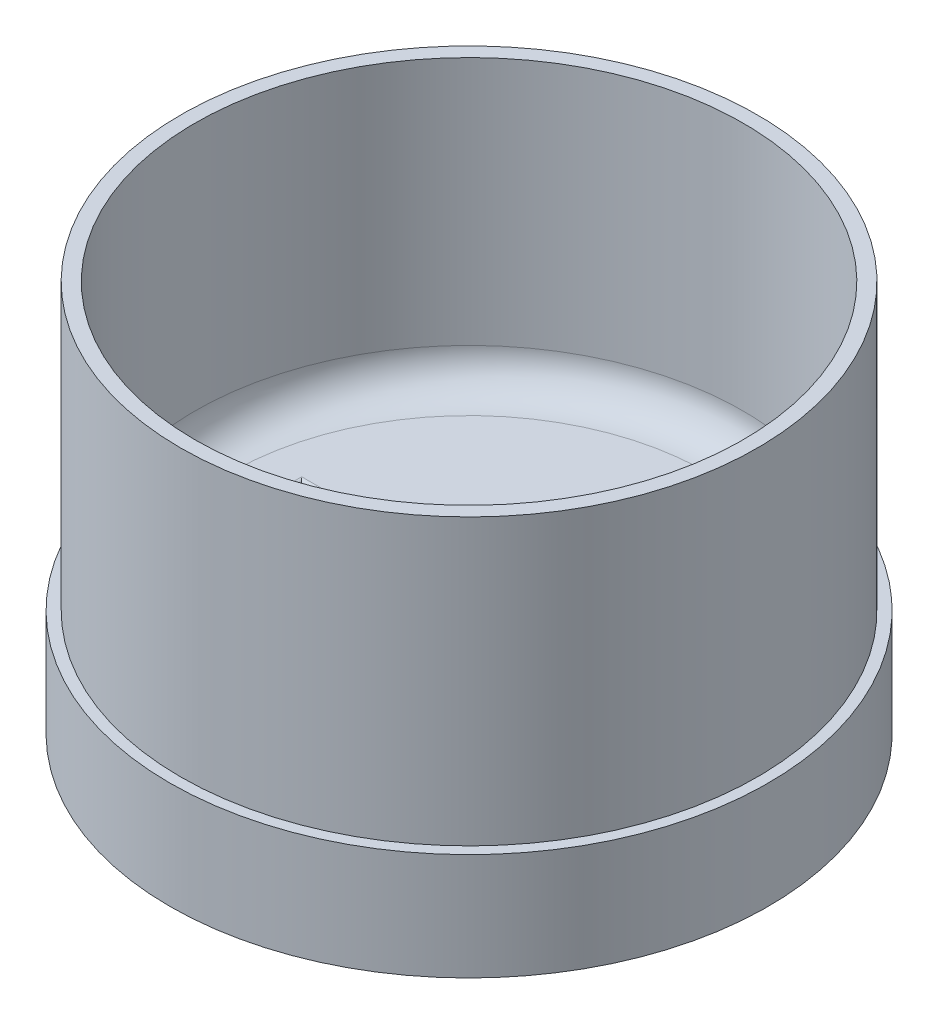
from build123d import *

# Parameters (mm, degrees)
SKETCH1_R           = 84
SKETCH1_R_2         = 79
BOSS_EXTRUDE1_DEPTH = 25
SKETCH2_R           = 84
BOSS_EXTRUDE2_DEPTH = 5
SKETCH3_R           = 81
SKETCH3_R_2         = 77
BOSS_EXTRUDE3_DEPTH = 80
FILLET1_R           = 10
CUT_EXTRUDE1_REACH  = 148.072
SKETCH4_W           = 14
SKETCH4_H           = 7
CUT_EXTRUDE2_REACH  = 145.22
SKETCH5_W           = 10
SKETCH5_H           = 16
FILLET2_R           = 1


with BuildPart() as part:
    # Sketch1 → Boss-Extrude1 (new body)
    with BuildSketch(Plane(origin=(0, 0, 0), x_dir=(1, 0, 0), z_dir=(0, 1, 0))):
        Circle(SKETCH1_R)
        Circle(SKETCH1_R_2, mode=Mode.SUBTRACT)
    extrude(amount=BOSS_EXTRUDE1_DEPTH)

    # Sketch2 → Boss-Extrude2 (add)
    with BuildSketch(Plane(origin=(0, 25, 0), x_dir=(1, 0, 0), z_dir=(0, 1, 0))):
        Circle(SKETCH2_R)
    extrude(amount=BOSS_EXTRUDE2_DEPTH)

    # Sketch3 → Boss-Extrude3 (add)
    with BuildSketch(Plane(origin=(0, 30, 0), x_dir=(1, 0, 0), z_dir=(0, 1, 0))):
        Circle(SKETCH3_R)
        Circle(SKETCH3_R_2, mode=Mode.SUBTRACT)
    extrude(amount=BOSS_EXTRUDE3_DEPTH)

    # Fillet1
    fillet1_edges = [part.edges().sort_by_distance(p)[0] for p in [
        (-79, 25, 0),
        (-77, 30, 0),
    ]]
    fillet(fillet1_edges, radius=FILLET1_R)

    # Sketch4 → Cut-Extrude1 (cut, up to next)
    with BuildSketch(Plane.XZ.offset(-25), mode=Mode.PRIVATE) as cut_extrude1_sk1:
        Rectangle(SKETCH4_W, SKETCH4_H)
    cut_extrude1_tool1 = extrude(cut_extrude1_sk1.sketch, amount=-CUT_EXTRUDE1_REACH, mode=Mode.PRIVATE) & part.part
    add(cut_extrude1_tool1.solids().sort_by_distance((0, 25, 0))[0], mode=Mode.SUBTRACT)

    # Sketch5 → Cut-Extrude2 (cut, up to next)
    with BuildSketch(Plane(origin=(0, 30, 0), x_dir=(1, 0, 0), z_dir=(0, 1, 0)), mode=Mode.PRIVATE) as cut_extrude2_sk1:
        with Locations((-50, 0)):
            Rectangle(SKETCH5_W, SKETCH5_H)
    cut_extrude2_tool1 = extrude(cut_extrude2_sk1.sketch, amount=-CUT_EXTRUDE2_REACH, mode=Mode.PRIVATE) & part.part
    add(cut_extrude2_tool1.solids().sort_by_distance((-50, 30, 0))[0], mode=Mode.SUBTRACT)

    # Fillet2
    fillet2_edges = [part.edges().sort_by_distance(p)[0] for p in [
        (-7, 25, 0),
        (0, 25, 3.5),
        (7, 25, 0),
        (0, 25, -3.5),
        (-7, 30, 0),
        (0, 30, 3.5),
        (7, 30, 0),
        (0, 30, -3.5),
        (-50, 30, -8),
        (-55, 30, 0),
        (-45, 30, 0),
        (-50, 30, 8),
        (-50, 25, -8),
        (-55, 25, 0),
        (-50, 25, 8),
        (-45, 25, 0),
    ]]
    fillet(fillet2_edges, radius=FILLET2_R)


solid = part.part
